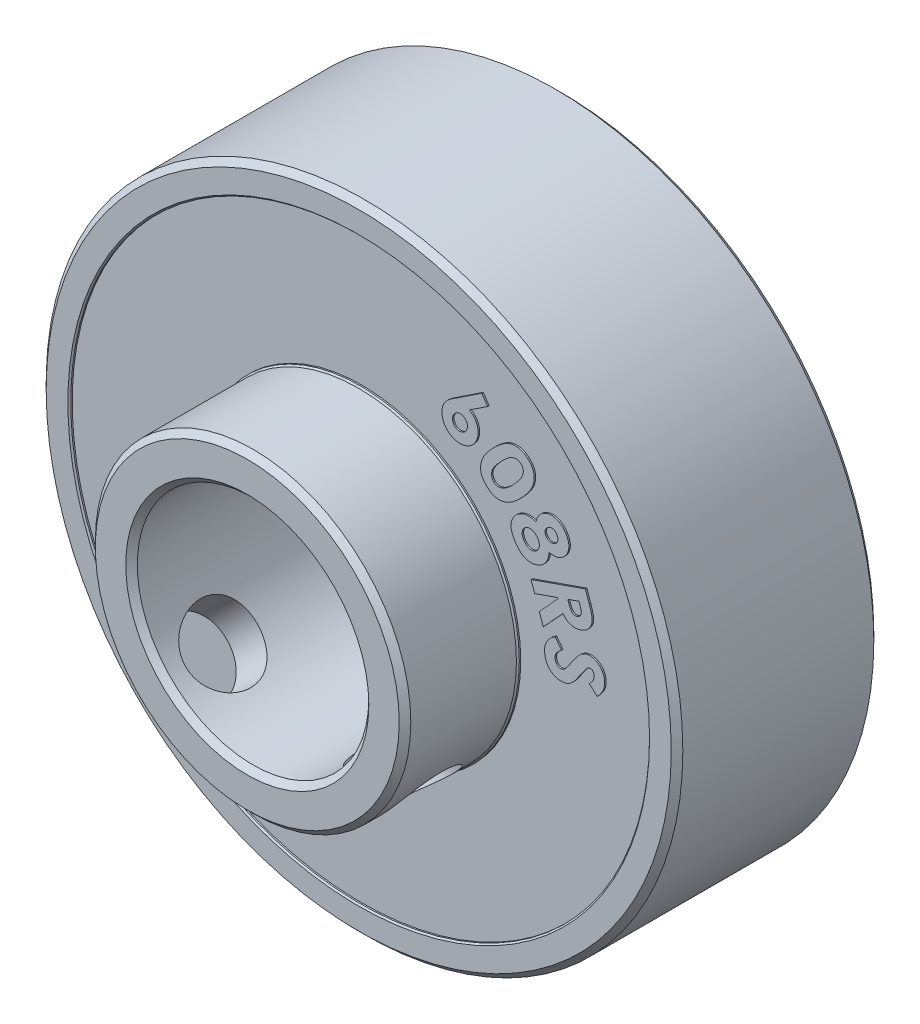
from build123d import *

# Parameters (mm, degrees)
SKETCH_1_R                      = 11
SKETCH_1_R_2                    = 4
EXTRUDE_1_DEPTH                 = 7
SKETCH_2_R                      = 10
SKETCH_2_R_2                    = 5.5
CUT_EXTRUDE_1_DEPTH             = 0.1
CUT_EXTRUDE_START               = -6.9
SKETCH_2_2_R                    = 10
SKETCH_2_2_R_2                  = 5.5
CUT_EXTRUDE_2_DEPTH             = 0.1
CHAMFER_1_SIZE                  = 0.05
SKETCH_3_R                      = 5.45
SKETCH_3_R_2                    = 4
EXTRUDE_2_DEPTH                 = 3.85
EXTRUDE_3_DEPTH                 = 0.05
EXTRUDE_4_DEPTH                 = 0.05
CHAMFER_2_SIZE                  = 0.2
HOLE_WIZARD_M31_D               = 2.5
HOLE_WIZARD_M31_DEPTH           = 5
HOLE_WIZARD_M31_TIP             = 0.751075774
HOLE_WIZARD_M31_ON_FACE_2_D     = 2.5
HOLE_WIZARD_M31_ON_FACE_2_DEPTH = 5
HOLE_WIZARD_M31_ON_FACE_2_TIP   = 0.751075774


with BuildPart() as part:
    # Эскиз1 → Бобышка-Вытянуть1 (new body)
    with BuildSketch(Plane.XY):
        Circle(SKETCH_1_R)
        Circle(SKETCH_1_R_2, mode=Mode.SUBTRACT)
    extrude(amount=EXTRUDE_1_DEPTH)

    # Эскиз2 → Вырез-Вытянуть1 (cut)
    with BuildSketch(Plane.XY.offset(7)):
        Circle(SKETCH_2_R)
        Circle(SKETCH_2_R_2, mode=Mode.SUBTRACT)
    extrude(amount=-CUT_EXTRUDE_1_DEPTH, mode=Mode.SUBTRACT)

    # Эскиз2<2> → Вырез-Вытянуть2 (cut)
    with BuildSketch(Plane.XY.offset(7).offset(CUT_EXTRUDE_START)):
        Circle(SKETCH_2_2_R)
        Circle(SKETCH_2_2_R_2, mode=Mode.SUBTRACT)
    extrude(amount=-CUT_EXTRUDE_2_DEPTH, mode=Mode.SUBTRACT)

    # Фаска1
    chamfer_1_edges = [part.edges().sort_by_distance(p)[0] for p in [
        (-5.5, 0, 0),
        (-5.5, 0, 7),
        (-10, 0, 7),
        (-10, 0, 0),
    ]]
    chamfer(chamfer_1_edges, length=CHAMFER_1_SIZE)

    # Эскиз3 → Бобышка-Вытянуть2 (add)
    with BuildSketch(Plane.XY.offset(7)):
        Circle(SKETCH_3_R)
        Circle(SKETCH_3_R_2, mode=Mode.SUBTRACT)
    extrude(amount=EXTRUDE_2_DEPTH)

    # Эскиз4 → Бобышка-Вытянуть3 (add)
    # profile 1 of 5: a face of its own
    with BuildSketch(Plane(origin=(0, 0, 0.1), x_dir=(-1, 0, 0), z_dir=(0, 0, -1))):
        with BuildLine():
            Line((8.19029949, 0.296762684), (7.915459746, 0.547964607))
            add(Edge.make_bspline(
                [(7.915459746, 0.547964607), (7.930212538, 0.561652705), (7.958620401, 0.5880104), (7.996327588, 0.629118684), (8.027634521, 0.669973123), (8.052746255, 0.710199301), (8.070948356, 0.750293238), (8.083411061, 0.789625849), (8.08946559, 0.828783287), (8.088037669, 0.854577687), (8.087334746, 0.867275505)],
                knots=[0, 0, 0, 0, 1.283643058, 2.471773221, 3.553897725, 4.563664135, 5.490235735, 6.35533973, 7.190382524, 8, 8, 8, 8], degree=3))
            add(Edge.make_bspline(
                [(8.087334746, 0.867275505), (8.085558773, 0.878973611), (8.082125644, 0.901587192), (8.071279685, 0.933093962), (8.055802359, 0.960805758), (8.03577539, 0.983623568), (8.013683645, 1.002156579), (7.990027468, 1.014988722), (7.965398511, 1.021989278), (7.948884251, 1.021409155), (7.940700131, 1.021121659)],
                knots=[0, 0, 0, 0, 1.207749352, 2.334697242, 3.386348666, 4.431866923, 5.42132409, 6.31922352, 7.167042535, 8, 8, 8, 8], degree=3))
            add(Edge.make_bspline(
                [(7.940700131, 1.021121659), (7.932621335, 1.019788328), (7.916352308, 1.017103275), (7.892835161, 1.008040019), (7.870663256, 0.994639244), (7.857349918, 0.983259209), (7.8505559, 0.977451787)],
                knots=[0, 0, 0, 0, 0.962820743, 1.938922399, 2.948197738, 4, 4, 4, 4], degree=3))
            add(Edge.make_bspline(
                [(7.8505559, 0.977451787), (7.84541126, 0.972172886), (7.833449413, 0.959898867), (7.814987093, 0.937231381), (7.792517843, 0.908811056), (7.766476502, 0.874109426), (7.736487579, 0.833524337), (7.703276191, 0.786289932), (7.666020447, 0.733319385), (7.640427557, 0.695574799), (7.626998208, 0.675769095)],
                knots=[0, 0, 0, 0, 0.470536925, 1.094049535, 1.865251957, 2.784627903, 3.864381354, 5.087794006, 6.471879073, 8, 8, 8, 8], degree=3))
            add(Edge.make_bspline(
                [(7.626998208, 0.675769095), (7.614640541, 0.657163929), (7.59117441, 0.62183434), (7.556915793, 0.572340715), (7.526894203, 0.528161762), (7.500632504, 0.48961279), (7.477330699, 0.457159711), (7.457614111, 0.430479971), (7.44217769, 0.408896208), (7.432465201, 0.396888513), (7.428280259, 0.391714607)],
                knots=[0, 0, 0, 0, 1.545917925, 2.935563431, 4.166209933, 5.243077074, 6.163962197, 6.931235012, 7.539487855, 8, 8, 8, 8], degree=3))
            add(Edge.make_bspline(
                [(7.428280259, 0.391714607), (7.4114759, 0.37182383), (7.379248179, 0.333676916), (7.328208941, 0.282837672), (7.277363857, 0.240609472), (7.226534591, 0.206027725), (7.174108624, 0.179103752), (7.119281824, 0.15825443), (7.061278872, 0.142730866), (7.021175822, 0.137275416), (7.000796284, 0.134503069)],
                knots=[0, 0, 0, 0, 1.216684991, 2.333381793, 3.361974081, 4.302038155, 5.200978211, 6.109832555, 7.039456128, 8, 8, 8, 8], degree=3))
            add(Edge.make_bspline(
                [(7.000796284, 0.134503069), (6.980912016, 0.132939575), (6.941838298, 0.12986722), (6.883982913, 0.131513012), (6.82825067, 0.138661818), (6.774544586, 0.151627333), (6.722756945, 0.169984056), (6.673281438, 0.194236918), (6.625975808, 0.223873764), (6.580966464, 0.258411534), (6.539486787, 0.297912458), (6.502409832, 0.341503294), (6.469838994, 0.388631019), (6.44154117, 0.439372329), (6.418347524, 0.49408404), (6.400061376, 0.552505823), (6.385829599, 0.614394453), (6.380248477, 0.657145995), (6.377398849, 0.678974223)],
                knots=[0, 0, 0, 0, 1.030268607, 2.024536377, 2.985077074, 3.929235972, 4.874504223, 5.819066673, 6.770888815, 7.755188857, 8.746217296, 9.725422457, 10.707590718, 11.702433264, 12.722899079, 13.772838986, 14.862848562, 16, 16, 16, 16], degree=3))
            add(Edge.make_bspline(
                [(6.377398849, 0.678974223), (6.375798997, 0.696321208), (6.372653038, 0.730432429), (6.372535986, 0.781177306), (6.375069038, 0.830462562), (6.381642251, 0.878375858), (6.391261519, 0.924960238), (6.403940592, 0.970331043), (6.420541605, 1.014242388), (6.440615795, 1.056859335), (6.464496118, 1.098276227), (6.491701076, 1.138889291), (6.523102827, 1.178239059), (6.558610982, 1.21622944), (6.597564644, 1.253669069), (6.640451848, 1.289953404), (6.686987923, 1.325474587), (6.720207941, 1.347309565), (6.73717449, 1.358461402)],
                knots=[0, 0, 0, 0, 1.024197967, 2.013989355, 2.98174725, 3.924932278, 4.855438404, 5.777986075, 6.692775885, 7.613415354, 8.545842579, 9.502280528, 10.486163035, 11.50337868, 12.558966263, 13.662340886, 14.806081068, 16, 16, 16, 16], degree=3))
            Line((6.73717449, 1.358461402), (6.961132823, 1.063589607))
            add(Edge.make_bspline(
                [(6.961132823, 1.063589607), (6.941783223, 1.04976002), (6.904640351, 1.023213188), (6.85527869, 0.979883822), (6.813922044, 0.936215765), (6.780990044, 0.891951698), (6.756355029, 0.847119192), (6.740509524, 0.801507386), (6.732160003, 0.755241067), (6.733901828, 0.724403811), (6.734770643, 0.7090223)],
                knots=[0, 0, 0, 0, 1.291115503, 2.478383912, 3.561174717, 4.552019659, 5.467235253, 6.327452426, 7.165739371, 8, 8, 8, 8], degree=3))
            add(Edge.make_bspline(
                [(6.734770643, 0.7090223), (6.737047017, 0.693544477), (6.741454544, 0.663576223), (6.756678186, 0.621468176), (6.778461183, 0.583906059), (6.806966887, 0.552326697), (6.838713363, 0.526585695), (6.873193107, 0.5093839), (6.908924688, 0.499647074), (6.93303441, 0.500608287), (6.945107182, 0.501089607)],
                knots=[0, 0, 0, 0, 1.144864229, 2.216693053, 3.261423878, 4.308950986, 5.319950067, 6.239695352, 7.118540031, 8, 8, 8, 8], degree=3))
            add(Edge.make_bspline(
                [(6.945107182, 0.501089607), (6.956297977, 0.502953883), (6.978992459, 0.50673456), (7.011813893, 0.520227563), (7.043931163, 0.539397657), (7.069731885, 0.560640774), (7.091417844, 0.581581651), (7.109058069, 0.602268001), (7.129286143, 0.626178242), (7.150790557, 0.654455491), (7.174432144, 0.686507292), (7.200054137, 0.722495214), (7.227281408, 0.762582694), (7.245640499, 0.790851961), (7.255203336, 0.805576787)],
                knots=[0, 0, 0, 0, 0.909333767, 1.844092184, 2.830712254, 3.906853886, 4.52164093, 5.251643528, 6.089918518, 7.038804142, 8.105700029, 9.291005529, 10.58894572, 12, 12, 12, 12], degree=3))
            add(Edge.make_bspline(
                [(7.255203336, 0.805576787), (7.273676701, 0.833547949), (7.309135378, 0.88723716), (7.361565684, 0.963513784), (7.411212619, 1.031981061), (7.457727497, 1.093115192), (7.501182872, 1.146904816), (7.541988013, 1.192995836), (7.579505878, 1.231717473), (7.624811187, 1.272495506), (7.680872882, 1.312783201), (7.749093256, 1.350896932), (7.819395634, 1.376597714), (7.867344655, 1.384303781), (7.891020643, 1.388108838)],
                knots=[0, 0, 0, 0, 1.354635275, 2.600152879, 3.740128057, 4.772053465, 5.704282852, 6.533881209, 7.258997855, 7.881984621, 8.994978827, 10.040768623, 11.032582161, 12, 12, 12, 12], degree=3))
            add(Edge.make_bspline(
                [(7.891020643, 1.388108838), (7.907837345, 1.389379919), (7.941058613, 1.391890929), (7.990627945, 1.389771243), (8.038890595, 1.382682444), (8.085784404, 1.369905718), (8.1315722, 1.352830166), (8.175904073, 1.330212525), (8.21850955, 1.302087689), (8.259844147, 1.270033589), (8.298457845, 1.234037671), (8.332687216, 1.194351501), (8.362795003, 1.152283012), (8.388809922, 1.107439648), (8.409857622, 1.05948486), (8.427255893, 1.009050899), (8.43972419, 0.955578355), (8.444613189, 0.918875245), (8.447110387, 0.900128069)],
                knots=[0, 0, 0, 0, 0.982658787, 1.941235034, 2.886113445, 3.821089462, 4.769842375, 5.731008605, 6.715886282, 7.742366117, 8.778049333, 9.788214007, 10.79299206, 11.790714915, 12.805102541, 13.84180981, 14.897641854, 16, 16, 16, 16], degree=3))
            add(Edge.make_bspline(
                [(8.447110387, 0.900128069), (8.448935719, 0.875698903), (8.452568899, 0.827074558), (8.446914222, 0.754085903), (8.432729231, 0.682042073), (8.413680399, 0.622888679), (8.393507869, 0.575406695), (8.374555687, 0.538716982), (8.352421563, 0.500825792), (8.326600844, 0.4621087), (8.297870618, 0.421941161), (8.265169611, 0.381074719), (8.229131565, 0.339066076), (8.203470577, 0.311111175), (8.19029949, 0.296762684)],
                knots=[0, 0, 0, 0, 1.297254647, 2.582083941, 3.866503492, 5.183090301, 5.868268373, 6.599732141, 7.370831279, 8.193636159, 9.066090408, 9.988293336, 10.967445722, 12, 12, 12, 12], degree=3))
        make_face()
    # profile 2 of 5: a face of its own
    with BuildSketch(Plane(origin=(0, 0, 0.1), x_dir=(-1, 0, 0), z_dir=(0, 0, -1))):
        with BuildLine():
            Line((7.783437326, 3.311270875), (7.916049505, 2.931863824))
            add(Edge.make_bspline(
                [(7.916049505, 2.931863824), (7.924769277, 2.906813762), (7.941572283, 2.858542271), (7.963024934, 2.788029468), (7.981292416, 2.722622896), (7.995695135, 2.662213175), (8.006872453, 2.606813373), (8.013669165, 2.556351502), (8.017163917, 2.510850173), (8.016823721, 2.469705288), (8.013181297, 2.4313611), (8.006195484, 2.394738008), (7.9970776, 2.358609232), (7.984653781, 2.323511961), (7.96914369, 2.289215094), (7.951395761, 2.255452582), (7.929654367, 2.223113567), (7.906410686, 2.190975053), (7.879929518, 2.160614922), (7.850983844, 2.132280666), (7.820175082, 2.105381599), (7.786052597, 2.081795139), (7.750622108, 2.058414709), (7.711991084, 2.038403077), (7.671445547, 2.019658329), (7.6431591, 2.00926096), (7.62878989, 2.003979209)],
                knots=[0, 0, 0, 0, 1.706955509, 3.289304765, 4.742725008, 6.076968942, 7.285589652, 8.378391958, 9.352075536, 10.220228812, 11.023312621, 11.827453633, 12.617553708, 13.419486802, 14.219759959, 15.038829142, 15.870829558, 16.725215705, 17.59038548, 18.459516813, 19.331194434, 20.218454335, 21.126861048, 22.061206263, 23.015113666, 24, 24, 24, 24], degree=3))
            add(Edge.make_bspline(
                [(7.62878989, 2.003979209), (7.613633286, 1.998940047), (7.58387039, 1.989044688), (7.538798529, 1.978394979), (7.494653902, 1.970684925), (7.451417635, 1.966152981), (7.40905723, 1.965274454), (7.3676703, 1.968216093), (7.327141762, 1.974045178), (7.287587328, 1.983779464), (7.249163118, 1.997053821), (7.211496131, 2.013653627), (7.174820214, 2.03367515), (7.138912407, 2.056937192), (7.104358371, 2.084204536), (7.070277885, 2.114486214), (7.037441286, 2.148719433), (7.016740509, 2.173330977), (7.006193736, 2.185870234)],
                knots=[0, 0, 0, 0, 1.096708063, 2.153596337, 3.177645909, 4.173531218, 5.136944437, 6.084015114, 7.02072131, 7.946310815, 8.877565628, 9.809949373, 10.770519432, 11.745049659, 12.745151267, 13.791154223, 14.874622174, 16, 16, 16, 16], degree=3))
            Line((7.006193736, 2.185870234), (6.326305916, 1.449091388))
            Line((6.326305916, 1.449091388), (6.189687326, 1.839716388))
            Line((6.189687326, 1.839716388), (6.837123223, 2.541639465))
            Line((6.837123223, 2.541639465), (6.825504634, 2.574492029))
            Line((6.825504634, 2.574492029), (6.029831557, 2.295645875))
            Line((6.029831557, 2.295645875), (5.904831557, 2.653418311))
            Line((5.904831557, 2.653418311), (7.783437326, 3.311270875))
        make_face()
        with BuildLine():
            Line((7.174062326, 2.696286901), (7.213725787, 2.584107414))
            add(Edge.make_bspline(
                [(7.213725787, 2.584107414), (7.218691825, 2.570443194), (7.228199165, 2.544283427), (7.243590818, 2.507335062), (7.25855833, 2.473783305), (7.274594183, 2.444335865), (7.290510547, 2.418541625), (7.306626959, 2.39661665), (7.322900646, 2.378338402), (7.340039177, 2.364089402), (7.357804561, 2.352860045), (7.376557924, 2.344495657), (7.396509399, 2.338777176), (7.417431195, 2.335993291), (7.439480594, 2.33620775), (7.462604378, 2.33850186), (7.486837126, 2.343916635), (7.503026628, 2.349069729), (7.511402069, 2.351735619)],
                knots=[0, 0, 0, 0, 1.601891661, 3.066776947, 4.410195398, 5.648149463, 6.758846487, 7.747826659, 8.643734474, 9.448322519, 10.195548691, 10.953137507, 11.703112172, 12.475283592, 13.269985724, 14.128109779, 15.031600479, 16, 16, 16, 16], degree=3))
            add(Edge.make_bspline(
                [(7.511402069, 2.351735619), (7.521147096, 2.35559951), (7.540209085, 2.363157563), (7.566074549, 2.378945612), (7.588463677, 2.398071694), (7.607385114, 2.420242858), (7.622629573, 2.444952802), (7.633390541, 2.471694709), (7.640549153, 2.499855194), (7.642219977, 2.524775568), (7.641954507, 2.546526319), (7.639054197, 2.565454062), (7.635740431, 2.587201882), (7.629849179, 2.61128605), (7.623047983, 2.638033071), (7.614660766, 2.667347576), (7.60409895, 2.699141683), (7.596615811, 2.721264102), (7.592732198, 2.732745234)],
                knots=[0, 0, 0, 0, 1.127833703, 2.206125587, 3.247006354, 4.287887121, 5.334123575, 6.360081624, 7.382502748, 8.450668697, 9.040729981, 9.722428417, 10.510067932, 11.410520644, 12.39108699, 13.483965865, 14.694224073, 16, 16, 16, 16], degree=3))
            Line((7.592732198, 2.732745234), (7.558277069, 2.830902286))
            Line((7.558277069, 2.830902286), (7.174062326, 2.696286901))
        make_face(mode=Mode.SUBTRACT)
    # profile 3 of 5: a face of its own
    with BuildSketch(Plane(origin=(0, 0, 0.1), x_dir=(-1, 0, 0), z_dir=(0, 0, -1))):
        with BuildLine():
            add(Edge.make_bspline(
                [(6.524956198, 3.777500663), (6.524304606, 3.75126623), (6.523019287, 3.69951662), (6.509214831, 3.623469832), (6.486888654, 3.550377208), (6.454692656, 3.481106031), (6.414135167, 3.416737269), (6.366520042, 3.357464227), (6.311106445, 3.304622347), (6.269210325, 3.275126123), (6.24811325, 3.260273099)],
                knots=[0, 0, 0, 0, 1.027340805, 2.026515475, 3.018313015, 4.016060567, 5.010961512, 5.993641018, 6.989684333, 8, 8, 8, 8], degree=3))
            add(Edge.make_bspline(
                [(6.24811325, 3.260273099), (6.224201635, 3.24561151), (6.17684081, 3.216571858), (6.099236998, 3.186803655), (6.01938164, 3.165575641), (5.937038073, 3.156819994), (5.855027357, 3.158202871), (5.775198976, 3.170467796), (5.699052471, 3.194578876), (5.638722513, 3.223379802), (5.592328757, 3.251989183), (5.558324524, 3.277540386), (5.524468605, 3.306017131), (5.491500637, 3.338079993), (5.458736035, 3.37313351), (5.426897068, 3.411715615), (5.394976108, 3.453295723), (5.375210263, 3.483040176), (5.365100429, 3.498253869)],
                knots=[0, 0, 0, 0, 1.303214694, 2.581227698, 3.852387222, 5.141062064, 6.422020446, 7.661855004, 8.886870759, 10.127110528, 10.763715695, 11.421492558, 12.105285765, 12.821976999, 13.560998413, 14.337908647, 15.149873567, 16, 16, 16, 16], degree=3))
            add(Edge.make_bspline(
                [(5.365100429, 3.498253869), (5.354502757, 3.514704801), (5.333927015, 3.546644847), (5.306890227, 3.595047921), (5.282338511, 3.641528806), (5.262354463, 3.687127168), (5.244439697, 3.730923542), (5.231573515, 3.773839499), (5.221254139, 3.81509366), (5.212673344, 3.868081762), (5.210257913, 3.933529132), (5.218138208, 4.011453013), (5.23833589, 4.088242466), (5.269077889, 4.163401809), (5.310608357, 4.23497626), (5.362631133, 4.300895298), (5.424017297, 4.360800087), (5.47130671, 4.394041983), (5.495308762, 4.410914125)],
                knots=[0, 0, 0, 0, 0.898227396, 1.743939131, 2.544713256, 3.310472017, 4.028938821, 4.715510003, 5.365398198, 5.980299854, 7.176961092, 8.360591663, 9.563707498, 10.809381662, 12.078734392, 13.349508007, 14.654725381, 16, 16, 16, 16], degree=3))
            add(Edge.make_bspline(
                [(5.495308762, 4.410914125), (5.517046647, 4.42416132), (5.559907764, 4.450281137), (5.628614186, 4.479326872), (5.698842436, 4.500288226), (5.771076481, 4.511315454), (5.845080326, 4.51387535), (5.920712713, 4.506597977), (5.998241639, 4.491231127), (6.049031122, 4.47388316), (6.075036327, 4.465000663)],
                knots=[0, 0, 0, 0, 1.00787022, 1.987242288, 2.947077545, 3.906153439, 4.875401634, 5.874657719, 6.911783381, 8, 8, 8, 8], degree=3))
            add(Edge.make_bspline(
                [(6.075036327, 4.465000663), (6.079748712, 4.485000462), (6.08900671, 4.524292258), (6.108878062, 4.580592191), (6.132866916, 4.633167242), (6.161056962, 4.68208808), (6.193554197, 4.727069924), (6.23039082, 4.768198609), (6.271094728, 4.805929575), (6.30165577, 4.82700098), (6.317023506, 4.837596817)],
                knots=[0, 0, 0, 0, 1.080470016, 2.122701697, 3.135136799, 4.117374167, 5.08859185, 6.049074693, 7.018969745, 8, 8, 8, 8], degree=3))
            add(Edge.make_bspline(
                [(6.317023506, 4.837596817), (6.338621255, 4.850591328), (6.381279936, 4.876257369), (6.450042003, 4.904438052), (6.521125204, 4.922536534), (6.593761558, 4.931015777), (6.66658219, 4.929470684), (6.738206504, 4.917758792), (6.807993188, 4.89585596), (6.875130473, 4.86347001), (6.939734421, 4.822231048), (6.999368558, 4.770616513), (7.055561568, 4.710751211), (7.087231726, 4.664839989), (7.103481839, 4.641282715)],
                knots=[0, 0, 0, 0, 0.997889349, 1.970975918, 2.932492279, 3.896932359, 4.860471542, 5.809804719, 6.763994604, 7.748871042, 8.756037824, 9.792283038, 10.867209569, 12, 12, 12, 12], degree=3))
            add(Edge.make_bspline(
                [(7.103481839, 4.641282715), (7.118266706, 4.617313906), (7.147135927, 4.570511938), (7.178984369, 4.496086455), (7.201762696, 4.421603302), (7.212798322, 4.346671449), (7.21415521, 4.272579683), (7.205418076, 4.199672689), (7.185759495, 4.128747746), (7.156971958, 4.060319699), (7.119520913, 3.996303386), (7.074614409, 3.93771315), (7.021994485, 3.885977177), (6.981835267, 3.857510527), (6.961654916, 3.843205792)],
                knots=[0, 0, 0, 0, 1.117294016, 2.181650263, 3.205496746, 4.203313101, 5.179532074, 6.141507601, 7.109258008, 8.093515385, 9.082507538, 10.047010183, 11.018605923, 12, 12, 12, 12], degree=3))
            add(Edge.make_bspline(
                [(6.961654916, 3.843205792), (6.946865794, 3.834091177), (6.917520408, 3.816005458), (6.871055379, 3.794448162), (6.823354409, 3.778282963), (6.773824196, 3.767141239), (6.720213606, 3.76162371), (6.660932763, 3.761454913), (6.594959848, 3.767025459), (6.549092294, 3.773888987), (6.524956198, 3.777500663)],
                knots=[0, 0, 0, 0, 0.918312471, 1.822165875, 2.702300176, 3.578058076, 4.501680321, 5.547167614, 6.70928807, 8, 8, 8, 8], degree=3))
        make_face()
        with BuildLine():
            add(Edge.make_bspline(
                [(6.792985044, 4.452180151), (6.784193133, 4.46416284), (6.767096261, 4.487464544), (6.734901369, 4.515655868), (6.698260579, 4.535858726), (6.658209729, 4.547577881), (6.616386986, 4.551923369), (6.57431036, 4.546702239), (6.532477779, 4.533439362), (6.506928956, 4.51817378), (6.493706198, 4.510273099)],
                knots=[0, 0, 0, 0, 1.042245895, 2.026765742, 2.980375271, 3.960320729, 4.940985148, 5.914300286, 6.920549047, 8, 8, 8, 8], degree=3))
            add(Edge.make_bspline(
                [(6.493706198, 4.510273099), (6.481273951, 4.501259963), (6.457078344, 4.483718619), (6.428218724, 4.449879888), (6.406350839, 4.411948623), (6.393096116, 4.370141725), (6.387590231, 4.326853426), (6.39146996, 4.283978738), (6.403334912, 4.24191666), (6.418307167, 4.216723511), (6.425997865, 4.203782715)],
                knots=[0, 0, 0, 0, 1.050136953, 2.043773826, 3.024360851, 4.035412181, 5.031916455, 5.997323732, 6.971298728, 8, 8, 8, 8], degree=3))
            add(Edge.make_bspline(
                [(6.425997865, 4.203782715), (6.435011379, 4.191354446), (6.45244255, 4.167319505), (6.485892403, 4.138647115), (6.523427725, 4.117682381), (6.564854226, 4.105334124), (6.608250747, 4.101721075), (6.65195102, 4.107155926), (6.695508259, 4.121394594), (6.722213073, 4.137380449), (6.736094019, 4.145689766)],
                knots=[0, 0, 0, 0, 1.038512025, 2.008370975, 2.961327375, 3.935787341, 4.91758916, 5.894068385, 6.905353861, 8, 8, 8, 8], degree=3))
            add(Edge.make_bspline(
                [(6.736094019, 4.145689766), (6.748494201, 4.15472618), (6.772393198, 4.172142151), (6.801283613, 4.205039318), (6.821620674, 4.242147084), (6.833728295, 4.282699071), (6.837325661, 4.325259879), (6.832037499, 4.368536184), (6.817067328, 4.411608544), (6.801236238, 4.438279303), (6.792985044, 4.452180151)],
                knots=[0, 0, 0, 0, 1.049071613, 2.02188637, 2.97209824, 3.927539907, 4.901086152, 5.878410172, 6.8942235, 8, 8, 8, 8], degree=3))
        make_face(mode=Mode.SUBTRACT)
        with BuildLine():
            add(Edge.make_bspline(
                [(6.136334403, 4.004664125), (6.13009776, 4.013874061), (6.11785514, 4.031953296), (6.096760064, 4.056514476), (6.074306033, 4.078383855), (6.050915758, 4.098498769), (6.025737138, 4.11559388), (5.998998784, 4.130127408), (5.971014648, 4.142231902), (5.941785246, 4.151195914), (5.912521492, 4.158134596), (5.883498299, 4.161892425), (5.855199959, 4.161970264), (5.827551938, 4.160548685), (5.800857083, 4.154321839), (5.774739409, 4.146706669), (5.749492095, 4.135210911), (5.733721651, 4.125435627), (5.725677352, 4.120449381)],
                knots=[0, 0, 0, 0, 1.124817388, 2.208032344, 3.268759496, 4.294831262, 5.325608786, 6.341574749, 7.370756504, 8.405071366, 9.431143132, 10.411710123, 11.357773941, 12.292672367, 13.204429581, 14.1234686, 15.042805637, 16, 16, 16, 16], degree=3))
            add(Edge.make_bspline(
                [(5.725677352, 4.120449381), (5.717529274, 4.114883698), (5.701561999, 4.10397698), (5.68010388, 4.084700625), (5.660992867, 4.064096017), (5.644205352, 4.041736022), (5.630411043, 4.017670084), (5.618371377, 3.992225053), (5.609936395, 3.96474385), (5.600554267, 3.926611276), (5.597012573, 3.876636245), (5.605317848, 3.815990821), (5.62666386, 3.755396987), (5.649123685, 3.717717789), (5.660773506, 3.69817374)],
                knots=[0, 0, 0, 0, 0.741926806, 1.453907122, 2.165177658, 2.854668687, 3.552822827, 4.249890908, 4.968227687, 5.711786598, 7.203414907, 8.704461029, 10.29061715, 12, 12, 12, 12], degree=3))
            add(Edge.make_bspline(
                [(5.660773506, 3.69817374), (5.667419067, 3.688432773), (5.68032333, 3.669517893), (5.701990641, 3.643861805), (5.723720515, 3.620157861), (5.747571594, 3.600482521), (5.771764178, 3.582691541), (5.797441383, 3.568450996), (5.823982749, 3.55672109), (5.859996585, 3.545016882), (5.906140241, 3.537875307), (5.961513481, 3.541793389), (6.016185928, 3.556831626), (6.048970267, 3.576358158), (6.065821583, 3.586394894)],
                knots=[0, 0, 0, 0, 0.898110874, 1.743939712, 2.557551234, 3.344755697, 4.096134693, 4.843573406, 5.577372218, 6.304860648, 7.72571922, 9.102920365, 10.510886413, 12, 12, 12, 12], degree=3))
            add(Edge.make_bspline(
                [(6.065821583, 3.586394894), (6.074104374, 3.592094128), (6.090343606, 3.603268041), (6.112047838, 3.62282216), (6.131556168, 3.643732013), (6.148263617, 3.666508804), (6.162537936, 3.690928681), (6.17409487, 3.716856498), (6.182971535, 3.744550922), (6.191374447, 3.783030953), (6.195208405, 3.832665775), (6.187873983, 3.892196313), (6.168263984, 3.950564247), (6.147169347, 3.986305941), (6.136334403, 4.004664125)],
                knots=[0, 0, 0, 0, 0.763890001, 1.497682027, 2.216418851, 2.93551438, 3.640997123, 4.363883981, 5.089761223, 5.848774416, 7.356060518, 8.850114758, 10.382108777, 12, 12, 12, 12], degree=3))
        make_face(mode=Mode.SUBTRACT)
    # profile 4 of 5: a face of its own
    with BuildSketch(Plane(origin=(0, 0, 0.1), x_dir=(-1, 0, 0), z_dir=(0, 0, -1))):
        with BuildLine():
            add(Edge.make_bspline(
                [(5.801031456, 6.207524346), (5.813924149, 6.19516843), (5.839258812, 6.170888556), (5.873240427, 6.131552721), (5.904337569, 6.091732955), (5.931202969, 6.050203969), (5.954578485, 6.00765238), (5.974175214, 5.963941836), (5.990412551, 5.919122663), (6.002811928, 5.87316911), (6.011288642, 5.825990893), (6.015662793, 5.777736132), (6.016039892, 5.728424058), (6.012315001, 5.678071857), (6.004775946, 5.626596852), (5.992439913, 5.574248861), (5.976901865, 5.52061597), (5.956647666, 5.465884361), (5.931706733, 5.409648841), (5.901395785, 5.351538184), (5.865064267, 5.291571875), (5.823556266, 5.229131962), (5.77584573, 5.164993724), (5.723039625, 5.09838208), (5.664069155, 5.030090285), (5.62220254, 4.984521939), (5.600710943, 4.961130116)],
                knots=[0, 0, 0, 0, 0.896879839, 1.762405055, 2.609389887, 3.433985627, 4.244867897, 5.046870708, 5.838672706, 6.637975543, 7.435699174, 8.244384643, 9.06985378, 9.910888981, 10.779297254, 11.681184557, 12.61131757, 13.583728112, 14.611264553, 15.700852567, 16.874782266, 18.133001721, 19.467173721, 20.890456197, 22.403762549, 24, 24, 24, 24], degree=3))
            add(Edge.make_bspline(
                [(5.600710943, 4.961130116), (5.578574221, 4.937730565), (5.53553699, 4.8922382), (5.470143519, 4.828685195), (5.406915097, 4.770678283), (5.345118899, 4.719024874), (5.285373377, 4.672743209), (5.227523425, 4.631969579), (5.170803391, 4.598001666), (5.116096466, 4.569016085), (5.06243213, 4.546170599), (5.010713129, 4.525910001), (4.959664435, 4.510976756), (4.909849023, 4.49902272), (4.861076695, 4.491450342), (4.813389159, 4.487710773), (4.766869748, 4.488076327), (4.72128448, 4.492499047), (4.676621178, 4.500918166), (4.632577225, 4.513575497), (4.588958731, 4.529896866), (4.545809118, 4.550660242), (4.503112836, 4.575039305), (4.460701317, 4.603269861), (4.419014914, 4.635790627), (4.392360922, 4.659940842), (4.378755815, 4.672267936)],
                knots=[0, 0, 0, 0, 1.62553563, 3.160293989, 4.601160432, 5.955180386, 7.223786167, 8.414819195, 9.52450069, 10.558549837, 11.536513283, 12.466596714, 13.360084421, 14.218407688, 15.050610811, 15.848251286, 16.630130654, 17.395360827, 18.156782084, 18.920586139, 19.705509938, 20.50443085, 21.334584377, 22.185145146, 23.073636135, 24, 24, 24, 24], degree=3))
            add(Edge.make_bspline(
                [(4.378755815, 4.672267936), (4.365634432, 4.685061046), (4.339843255, 4.710206974), (4.304648643, 4.750063775), (4.272741847, 4.79028845), (4.245499753, 4.831912791), (4.221613223, 4.874121738), (4.20164739, 4.917262906), (4.185365472, 4.961289792), (4.173362624, 5.006229307), (4.165360005, 5.052232285), (4.161057919, 5.099112779), (4.159946093, 5.147101322), (4.164134458, 5.19604944), (4.170472007, 5.246243105), (4.182172222, 5.297251014), (4.196962286, 5.349286742), (4.21546285, 5.402866783), (4.239285853, 5.457901636), (4.268834207, 5.514908125), (4.303815023, 5.574323931), (4.344730164, 5.635979916), (4.39190103, 5.699589283), (4.444457346, 5.765806637), (4.502875575, 5.834210328), (4.544736781, 5.879668888), (4.566255815, 5.903037167)],
                knots=[0, 0, 0, 0, 0.93145521, 1.830853238, 2.701521204, 3.539567412, 4.357371131, 5.165476893, 5.953858164, 6.741156795, 7.527048697, 8.324992091, 9.133126379, 9.96376784, 10.820341906, 11.703392463, 12.621159873, 13.570315713, 14.583154331, 15.667295202, 16.832996866, 18.087234292, 19.427652897, 20.858187109, 22.384929949, 24, 24, 24, 24], degree=3))
            add(Edge.make_bspline(
                [(4.566255815, 5.903037167), (4.596827081, 5.934964931), (4.655824296, 5.996579952), (4.745593631, 6.081166655), (4.832620022, 6.155531077), (4.917492881, 6.218720737), (4.999409849, 6.27248489), (5.079241472, 6.314911903), (5.156191022, 6.348236977), (5.208016495, 6.361707711), (5.232922482, 6.368181398)],
                knots=[0, 0, 0, 0, 1.287451315, 2.484556693, 3.591331551, 4.619887002, 5.565116891, 6.442227226, 7.251374558, 8, 8, 8, 8], degree=3))
            add(Edge.make_bspline(
                [(5.232922482, 6.368181398), (5.259279446, 6.373132216), (5.311020478, 6.382851106), (5.38873757, 6.385634438), (5.464011498, 6.379965509), (5.536719427, 6.36406757), (5.60708657, 6.338928427), (5.675008317, 6.30461439), (5.740730452, 6.261103079), (5.78060957, 6.225669629), (5.801031456, 6.207524346)],
                knots=[0, 0, 0, 0, 1.043642178, 2.048761185, 3.019736125, 3.97808078, 4.939232424, 5.92356981, 6.936671029, 8, 8, 8, 8], degree=3))
        make_face()
        with BuildLine():
            add(Edge.make_bspline(
                [(5.561448123, 5.937892936), (5.54949212, 5.948094367), (5.526055929, 5.968091241), (5.48526411, 5.990222344), (5.441166125, 6.004103016), (5.40219865, 6.00973176), (5.369591787, 6.010643547), (5.343747909, 6.007364632), (5.316691723, 6.002411823), (5.288853121, 5.993630665), (5.259641396, 5.982944659), (5.229805065, 5.968561691), (5.198284581, 5.952284519), (5.165827919, 5.932324526), (5.131501983, 5.909533566), (5.095831072, 5.882268356), (5.057770723, 5.851541594), (5.017762092, 5.816430382), (4.97530072, 5.777819734), (4.931290096, 5.734585593), (4.884755595, 5.687887076), (4.853570697, 5.654849218), (4.837489789, 5.637812808)],
                knots=[0, 0, 0, 0, 1.078457542, 2.113995491, 3.165252164, 4.24183154, 4.8112373, 5.402439376, 6.029159191, 6.700255689, 7.406374243, 8.166383653, 8.9755623, 9.844875258, 10.784663416, 11.807625589, 12.93055478, 14.147713473, 15.467127592, 16.876286332, 18.389215538, 20, 20, 20, 20], degree=3))
            add(Edge.make_bspline(
                [(4.837489789, 5.637812808), (4.817040713, 5.615509933), (4.777765071, 5.572673781), (4.72358216, 5.508851829), (4.676000212, 5.448681173), (4.636315581, 5.39120832), (4.603214592, 5.337542892), (4.576727967, 5.287418759), (4.557496626, 5.240503726), (4.545677609, 5.196541141), (4.539589736, 5.155502193), (4.537998194, 5.116969893), (4.54005798, 5.080309837), (4.547439043, 5.045872129), (4.558631271, 5.013497936), (4.574165414, 4.983227409), (4.594136837, 4.955123298), (4.610485374, 4.938615556), (4.618739789, 4.930280757)],
                knots=[0, 0, 0, 0, 1.764330829, 3.388672662, 4.881067554, 6.235525549, 7.458945136, 8.556138335, 9.538053795, 10.408906489, 11.204079648, 11.952336581, 12.654775104, 13.339019898, 13.999083847, 14.646906155, 15.316819627, 16, 16, 16, 16], degree=3))
            add(Edge.make_bspline(
                [(4.618739789, 4.930280757), (4.627241972, 4.922969808), (4.643986105, 4.908571683), (4.671887381, 4.891244126), (4.701417265, 4.878239617), (4.732609899, 4.869779355), (4.765527544, 4.865754705), (4.799954191, 4.866443213), (4.836028136, 4.870687125), (4.859985852, 4.876962951), (4.872345559, 4.880200628)],
                knots=[0, 0, 0, 0, 0.990256165, 1.950202826, 2.891302884, 3.833661247, 4.797304066, 5.812790631, 6.87162592, 8, 8, 8, 8], degree=3))
            add(Edge.make_bspline(
                [(4.872345559, 4.880200628), (4.888239843, 4.885466484), (4.921729172, 4.896561665), (4.971713666, 4.921276575), (5.02428298, 4.952714721), (5.079174526, 4.991458443), (5.136493986, 5.0374372), (5.196364395, 5.090401555), (5.259185568, 5.150147434), (5.300431109, 5.193703881), (5.321864789, 5.216338449)],
                knots=[0, 0, 0, 0, 0.707909902, 1.491569345, 2.353275058, 3.298764867, 4.332382232, 5.461687153, 6.680938905, 8, 8, 8, 8], degree=3))
            add(Edge.make_bspline(
                [(5.321864789, 5.216338449), (5.343122606, 5.23943443), (5.384079707, 5.283933093), (5.440429588, 5.350152791), (5.48954109, 5.412895734), (5.53175079, 5.471472335), (5.566683898, 5.526595246), (5.593991726, 5.578177571), (5.614630273, 5.626023181), (5.627649962, 5.67078917), (5.634880992, 5.71248432), (5.63789165, 5.751686534), (5.636437143, 5.788568573), (5.630412955, 5.823218701), (5.619901141, 5.855597497), (5.605110815, 5.8858054), (5.585535276, 5.913595223), (5.569573787, 5.92969624), (5.561448123, 5.937892936)],
                knots=[0, 0, 0, 0, 1.790505423, 3.449738563, 4.958437556, 6.334645182, 7.566924544, 8.677841254, 9.661171365, 10.533905407, 11.33046538, 12.071346386, 12.772877167, 13.430424381, 14.071254209, 14.708360098, 15.342452786, 16, 16, 16, 16], degree=3))
        make_face(mode=Mode.SUBTRACT)
    # profile 5 of 5: a face of its own
    with BuildSketch(Plane(origin=(0, 0, 0.1), x_dir=(-1, 0, 0), z_dir=(0, 0, -1))):
        with BuildLine():
            Line((4.204330023, 7.378835528), (4.405451818, 7.080758605))
            Line((4.405451818, 7.080758605), (3.771237074, 6.662489374))
            add(Edge.make_bspline(
                [(3.771237074, 6.662489374), (3.788948954, 6.651870835), (3.823829351, 6.63095951), (3.871823477, 6.594203067), (3.914749666, 6.553410061), (3.953715543, 6.509517197), (3.986416935, 6.460769843), (4.015222891, 6.40891339), (4.038725909, 6.352970088), (4.057443164, 6.294120739), (4.070599254, 6.233620565), (4.07790034, 6.172716553), (4.079228374, 6.112171987), (4.073970464, 6.0518571), (4.062070404, 5.992103974), (4.044788927, 5.932359507), (4.021322095, 5.872886796), (4.000800903, 5.834840366), (3.990387715, 5.815534246)],
                knots=[0, 0, 0, 0, 1.01594452, 2.000722089, 2.967966702, 3.927721352, 4.883143816, 5.851102988, 6.843747715, 7.864529688, 8.887003591, 9.886654211, 10.879473055, 11.86266964, 12.86052468, 13.873658011, 14.921017937, 16, 16, 16, 16], degree=3))
            add(Edge.make_bspline(
                [(3.990387715, 5.815534246), (3.979568037, 5.797236083), (3.958268039, 5.761213677), (3.919849288, 5.712481993), (3.879388109, 5.667394465), (3.833755664, 5.628444703), (3.784983061, 5.593781209), (3.73206478, 5.564504211), (3.675710328, 5.540006158), (3.616435273, 5.520513129), (3.55566895, 5.506662972), (3.49478542, 5.498297041), (3.434642606, 5.496979323), (3.375145197, 5.500703819), (3.3164849, 5.511318428), (3.258456363, 5.527984367), (3.200973239, 5.550158103), (3.164349044, 5.56968588), (3.145836433, 5.579556682)],
                knots=[0, 0, 0, 0, 1.044355035, 2.055954016, 3.046108564, 4.01929933, 4.999711365, 5.984732998, 6.987787716, 8.018022592, 9.048927268, 10.04939801, 11.034988855, 12.002756169, 12.976810999, 13.960232698, 14.968948864, 16, 16, 16, 16], degree=3))
            add(Edge.make_bspline(
                [(3.145836433, 5.579556682), (3.126900784, 5.590809206), (3.089767666, 5.612875592), (3.038915686, 5.651766519), (2.993641834, 5.694377274), (2.95302519, 5.74017481), (2.918424422, 5.790325388), (2.88925237, 5.844140103), (2.864931095, 5.901520205), (2.846519572, 5.961864927), (2.833250825, 6.023391038), (2.826203937, 6.084577253), (2.823872151, 6.144498742), (2.827810032, 6.203211252), (2.838212101, 6.260531864), (2.853173011, 6.316772679), (2.874548952, 6.371671255), (2.892952523, 6.406512466), (2.90224669, 6.424107964)],
                knots=[0, 0, 0, 0, 1.081888934, 2.121601975, 3.138545199, 4.133886447, 5.124368109, 6.125944256, 7.137769764, 8.18205145, 9.222220187, 10.226867113, 11.205402434, 12.165941497, 13.112315172, 14.064475316, 15.022521888, 16, 16, 16, 16], degree=3))
            add(Edge.make_bspline(
                [(2.90224669, 6.424107964), (2.910044621, 6.437334588), (2.925715714, 6.46391544), (2.953261568, 6.501442495), (2.983354204, 6.537701428), (3.011312844, 6.566804718), (3.036983313, 6.590155052), (3.059591344, 6.609655966), (3.085863372, 6.630529392), (3.11551908, 6.652972296), (3.148943875, 6.67691527), (3.185556775, 6.70305142), (3.226129647, 6.730085917), (3.25426887, 6.748639551), (3.268833228, 6.758242579)],
                knots=[0, 0, 0, 0, 1.101910966, 2.214452613, 3.337892719, 4.484022691, 5.108442505, 5.829247805, 6.627479611, 7.517388936, 8.499500422, 9.579708563, 10.74730053, 12, 12, 12, 12], degree=3))
            Line((3.268833228, 6.758242579), (4.204330023, 7.378835528))
        make_face()
        with BuildLine():
            add(Edge.make_bspline(
                [(3.576926177, 6.361607964), (3.561709724, 6.369292664), (3.532055196, 6.384268964), (3.483253287, 6.394005894), (3.433831049, 6.394320254), (3.384691225, 6.382882802), (3.337565185, 6.363314648), (3.295005729, 6.334070127), (3.257806818, 6.296313051), (3.238891001, 6.265873356), (3.229169766, 6.250229759)],
                knots=[0, 0, 0, 0, 1.000533138, 1.94988536, 2.902234447, 3.893374452, 4.902047154, 5.893155908, 6.917248627, 8, 8, 8, 8], degree=3))
            add(Edge.make_bspline(
                [(3.229169766, 6.250229759), (3.220864632, 6.233808281), (3.204656611, 6.201760679), (3.192372983, 6.14967388), (3.189723737, 6.097047863), (3.197899343, 6.045124659), (3.214835188, 5.996428523), (3.239947163, 5.953633769), (3.272607071, 5.917359646), (3.299623629, 5.900030568), (3.313304382, 5.8912554)],
                knots=[0, 0, 0, 0, 1.076981574, 2.101800953, 3.114161618, 4.153007014, 5.167065966, 6.122976348, 7.049505219, 8, 8, 8, 8], degree=3))
            add(Edge.make_bspline(
                [(3.313304382, 5.8912554), (3.328526115, 5.883591915), (3.358567236, 5.868467508), (3.408033862, 5.858449103), (3.4586791, 5.857922848), (3.509402985, 5.8681622), (3.558258303, 5.887520741), (3.602435839, 5.916631075), (3.640929569, 5.954859328), (3.660318308, 5.985894159), (3.670275536, 6.001832323)],
                knots=[0, 0, 0, 0, 0.979454186, 1.933019191, 2.880745447, 3.885599153, 4.898572784, 5.894406185, 6.918656956, 8, 8, 8, 8], degree=3))
            add(Edge.make_bspline(
                [(3.670275536, 6.001832323), (3.678752492, 6.018239556), (3.695271373, 6.050212012), (3.707306685, 6.101994707), (3.710298487, 6.153863375), (3.701312052, 6.204786773), (3.684345201, 6.253330727), (3.656920121, 6.296211227), (3.621686509, 6.334004176), (3.592121677, 6.352236867), (3.576926177, 6.361607964)],
                knots=[0, 0, 0, 0, 1.063904892, 2.073210741, 3.047110242, 4.048560298, 5.042602281, 6.000113883, 6.972114167, 8, 8, 8, 8], degree=3))
        make_face(mode=Mode.SUBTRACT)
    extrude(amount=EXTRUDE_3_DEPTH)

    # Эскиз6 → Бобышка-Вытянуть4 (add)
    # profile 1 of 5: a face of its own
    with BuildSketch(Plane.XY.offset(6.9)):
        with BuildLine():
            Line((8.19029949, 0.296762684), (7.915459746, 0.547964607))
            add(Edge.make_bspline(
                [(7.915459746, 0.547964607), (7.930212538, 0.561652705), (7.958620401, 0.5880104), (7.996327588, 0.629118684), (8.027634521, 0.669973123), (8.052746255, 0.710199301), (8.070948356, 0.750293238), (8.083411061, 0.789625849), (8.08946559, 0.828783287), (8.088037669, 0.854577687), (8.087334746, 0.867275505)],
                knots=[0, 0, 0, 0, 1.283643058, 2.471773221, 3.553897725, 4.563664135, 5.490235735, 6.35533973, 7.190382524, 8, 8, 8, 8], degree=3))
            add(Edge.make_bspline(
                [(8.087334746, 0.867275505), (8.085558773, 0.878973611), (8.082125644, 0.901587192), (8.071279685, 0.933093962), (8.055802359, 0.960805758), (8.03577539, 0.983623568), (8.013683645, 1.002156579), (7.990027468, 1.014988722), (7.965398511, 1.021989278), (7.948884251, 1.021409155), (7.940700131, 1.021121659)],
                knots=[0, 0, 0, 0, 1.207749352, 2.334697242, 3.386348666, 4.431866923, 5.42132409, 6.31922352, 7.167042535, 8, 8, 8, 8], degree=3))
            add(Edge.make_bspline(
                [(7.940700131, 1.021121659), (7.932621335, 1.019788328), (7.916352308, 1.017103275), (7.892835161, 1.008040019), (7.870663256, 0.994639244), (7.857349918, 0.983259209), (7.8505559, 0.977451787)],
                knots=[0, 0, 0, 0, 0.962820743, 1.938922399, 2.948197738, 4, 4, 4, 4], degree=3))
            add(Edge.make_bspline(
                [(7.8505559, 0.977451787), (7.84541126, 0.972172886), (7.833449413, 0.959898867), (7.814987093, 0.937231381), (7.792517843, 0.908811056), (7.766476502, 0.874109426), (7.736487579, 0.833524337), (7.703276191, 0.786289932), (7.666020447, 0.733319385), (7.640427557, 0.695574799), (7.626998208, 0.675769095)],
                knots=[0, 0, 0, 0, 0.470536925, 1.094049535, 1.865251957, 2.784627903, 3.864381354, 5.087794006, 6.471879073, 8, 8, 8, 8], degree=3))
            add(Edge.make_bspline(
                [(7.626998208, 0.675769095), (7.614640541, 0.657163929), (7.59117441, 0.62183434), (7.556915793, 0.572340715), (7.526894203, 0.528161762), (7.500632504, 0.48961279), (7.477330699, 0.457159711), (7.457614111, 0.430479971), (7.44217769, 0.408896208), (7.432465201, 0.396888513), (7.428280259, 0.391714607)],
                knots=[0, 0, 0, 0, 1.545917925, 2.935563431, 4.166209933, 5.243077074, 6.163962197, 6.931235012, 7.539487855, 8, 8, 8, 8], degree=3))
            add(Edge.make_bspline(
                [(7.428280259, 0.391714607), (7.4114759, 0.37182383), (7.379248179, 0.333676916), (7.328208941, 0.282837672), (7.277363857, 0.240609472), (7.226534591, 0.206027725), (7.174108624, 0.179103752), (7.119281824, 0.15825443), (7.061278872, 0.142730866), (7.021175822, 0.137275416), (7.000796284, 0.134503069)],
                knots=[0, 0, 0, 0, 1.216684991, 2.333381793, 3.361974081, 4.302038155, 5.200978211, 6.109832555, 7.039456128, 8, 8, 8, 8], degree=3))
            add(Edge.make_bspline(
                [(7.000796284, 0.134503069), (6.980912016, 0.132939575), (6.941838298, 0.12986722), (6.883982913, 0.131513012), (6.82825067, 0.138661818), (6.774544586, 0.151627333), (6.722756945, 0.169984056), (6.673281438, 0.194236918), (6.625975808, 0.223873764), (6.580966464, 0.258411534), (6.539486787, 0.297912458), (6.502409832, 0.341503294), (6.469838994, 0.388631019), (6.44154117, 0.439372329), (6.418347524, 0.49408404), (6.400061376, 0.552505823), (6.385829599, 0.614394453), (6.380248477, 0.657145995), (6.377398849, 0.678974223)],
                knots=[0, 0, 0, 0, 1.030268607, 2.024536377, 2.985077074, 3.929235972, 4.874504223, 5.819066673, 6.770888815, 7.755188857, 8.746217296, 9.725422457, 10.707590718, 11.702433264, 12.722899079, 13.772838986, 14.862848562, 16, 16, 16, 16], degree=3))
            add(Edge.make_bspline(
                [(6.377398849, 0.678974223), (6.375798997, 0.696321208), (6.372653038, 0.730432429), (6.372535986, 0.781177306), (6.375069038, 0.830462562), (6.381642251, 0.878375858), (6.391261519, 0.924960238), (6.403940592, 0.970331043), (6.420541605, 1.014242388), (6.440615795, 1.056859335), (6.464496118, 1.098276227), (6.491701076, 1.138889291), (6.523102827, 1.178239059), (6.558610982, 1.21622944), (6.597564644, 1.253669069), (6.640451848, 1.289953404), (6.686987923, 1.325474587), (6.720207941, 1.347309565), (6.73717449, 1.358461402)],
                knots=[0, 0, 0, 0, 1.024197967, 2.013989355, 2.98174725, 3.924932278, 4.855438404, 5.777986075, 6.692775885, 7.613415354, 8.545842579, 9.502280528, 10.486163035, 11.50337868, 12.558966263, 13.662340886, 14.806081068, 16, 16, 16, 16], degree=3))
            Line((6.73717449, 1.358461402), (6.961132823, 1.063589607))
            add(Edge.make_bspline(
                [(6.961132823, 1.063589607), (6.941783223, 1.04976002), (6.904640351, 1.023213188), (6.85527869, 0.979883822), (6.813922044, 0.936215765), (6.780990044, 0.891951698), (6.756355029, 0.847119192), (6.740509524, 0.801507386), (6.732160003, 0.755241067), (6.733901828, 0.724403811), (6.734770643, 0.7090223)],
                knots=[0, 0, 0, 0, 1.291115503, 2.478383912, 3.561174717, 4.552019659, 5.467235253, 6.327452426, 7.165739371, 8, 8, 8, 8], degree=3))
            add(Edge.make_bspline(
                [(6.734770643, 0.7090223), (6.737047017, 0.693544477), (6.741454544, 0.663576223), (6.756678186, 0.621468176), (6.778461183, 0.583906059), (6.806966887, 0.552326697), (6.838713363, 0.526585695), (6.873193107, 0.5093839), (6.908924688, 0.499647074), (6.93303441, 0.500608287), (6.945107182, 0.501089607)],
                knots=[0, 0, 0, 0, 1.144864229, 2.216693053, 3.261423878, 4.308950986, 5.319950067, 6.239695352, 7.118540031, 8, 8, 8, 8], degree=3))
            add(Edge.make_bspline(
                [(6.945107182, 0.501089607), (6.956297977, 0.502953883), (6.978992459, 0.50673456), (7.011813893, 0.520227563), (7.043931163, 0.539397657), (7.069731885, 0.560640774), (7.091417844, 0.581581651), (7.109058069, 0.602268001), (7.129286143, 0.626178242), (7.150790557, 0.654455491), (7.174432144, 0.686507292), (7.200054137, 0.722495214), (7.227281408, 0.762582694), (7.245640499, 0.790851961), (7.255203336, 0.805576787)],
                knots=[0, 0, 0, 0, 0.909333767, 1.844092184, 2.830712254, 3.906853886, 4.52164093, 5.251643528, 6.089918518, 7.038804142, 8.105700029, 9.291005529, 10.58894572, 12, 12, 12, 12], degree=3))
            add(Edge.make_bspline(
                [(7.255203336, 0.805576787), (7.273676701, 0.833547949), (7.309135378, 0.88723716), (7.361565684, 0.963513784), (7.411212619, 1.031981061), (7.457727497, 1.093115192), (7.501182872, 1.146904816), (7.541988013, 1.192995836), (7.579505878, 1.231717473), (7.624811187, 1.272495506), (7.680872882, 1.312783201), (7.749093256, 1.350896932), (7.819395634, 1.376597714), (7.867344655, 1.384303781), (7.891020643, 1.388108838)],
                knots=[0, 0, 0, 0, 1.354635275, 2.600152879, 3.740128057, 4.772053465, 5.704282852, 6.533881209, 7.258997855, 7.881984621, 8.994978827, 10.040768623, 11.032582161, 12, 12, 12, 12], degree=3))
            add(Edge.make_bspline(
                [(7.891020643, 1.388108838), (7.907837345, 1.389379919), (7.941058613, 1.391890929), (7.990627945, 1.389771243), (8.038890595, 1.382682444), (8.085784404, 1.369905718), (8.1315722, 1.352830166), (8.175904073, 1.330212525), (8.21850955, 1.302087689), (8.259844147, 1.270033589), (8.298457845, 1.234037671), (8.332687216, 1.194351501), (8.362795003, 1.152283012), (8.388809922, 1.107439648), (8.409857622, 1.05948486), (8.427255893, 1.009050899), (8.43972419, 0.955578355), (8.444613189, 0.918875245), (8.447110387, 0.900128069)],
                knots=[0, 0, 0, 0, 0.982658787, 1.941235034, 2.886113445, 3.821089462, 4.769842375, 5.731008605, 6.715886282, 7.742366117, 8.778049333, 9.788214007, 10.79299206, 11.790714915, 12.805102541, 13.84180981, 14.897641854, 16, 16, 16, 16], degree=3))
            add(Edge.make_bspline(
                [(8.447110387, 0.900128069), (8.448935719, 0.875698903), (8.452568899, 0.827074558), (8.446914222, 0.754085903), (8.432729231, 0.682042073), (8.413680399, 0.622888679), (8.393507869, 0.575406695), (8.374555687, 0.538716982), (8.352421563, 0.500825792), (8.326600844, 0.4621087), (8.297870618, 0.421941161), (8.265169611, 0.381074719), (8.229131565, 0.339066076), (8.203470577, 0.311111175), (8.19029949, 0.296762684)],
                knots=[0, 0, 0, 0, 1.297254647, 2.582083941, 3.866503492, 5.183090301, 5.868268373, 6.599732141, 7.370831279, 8.193636159, 9.066090408, 9.988293336, 10.967445722, 12, 12, 12, 12], degree=3))
        make_face()
    # profile 2 of 5: a face of its own
    with BuildSketch(Plane.XY.offset(6.9)):
        with BuildLine():
            Line((7.783437326, 3.311270875), (7.916049505, 2.931863824))
            add(Edge.make_bspline(
                [(7.916049505, 2.931863824), (7.924769277, 2.906813762), (7.941572283, 2.858542271), (7.963024934, 2.788029468), (7.981292416, 2.722622896), (7.995695135, 2.662213175), (8.006872453, 2.606813373), (8.013669165, 2.556351502), (8.017163917, 2.510850173), (8.016823721, 2.469705288), (8.013181297, 2.4313611), (8.006195484, 2.394738008), (7.9970776, 2.358609232), (7.984653781, 2.323511961), (7.96914369, 2.289215094), (7.951395761, 2.255452582), (7.929654367, 2.223113567), (7.906410686, 2.190975053), (7.879929518, 2.160614922), (7.850983844, 2.132280666), (7.820175082, 2.105381599), (7.786052597, 2.081795139), (7.750622108, 2.058414709), (7.711991084, 2.038403077), (7.671445547, 2.019658329), (7.6431591, 2.00926096), (7.62878989, 2.003979209)],
                knots=[0, 0, 0, 0, 1.706955509, 3.289304765, 4.742725008, 6.076968942, 7.285589652, 8.378391958, 9.352075536, 10.220228812, 11.023312621, 11.827453633, 12.617553708, 13.419486802, 14.219759959, 15.038829142, 15.870829558, 16.725215705, 17.59038548, 18.459516813, 19.331194434, 20.218454335, 21.126861048, 22.061206263, 23.015113666, 24, 24, 24, 24], degree=3))
            add(Edge.make_bspline(
                [(7.62878989, 2.003979209), (7.613633286, 1.998940047), (7.58387039, 1.989044688), (7.538798529, 1.978394979), (7.494653902, 1.970684925), (7.451417635, 1.966152981), (7.40905723, 1.965274454), (7.3676703, 1.968216093), (7.327141762, 1.974045178), (7.287587328, 1.983779464), (7.249163118, 1.997053821), (7.211496131, 2.013653627), (7.174820214, 2.03367515), (7.138912407, 2.056937192), (7.104358371, 2.084204536), (7.070277885, 2.114486214), (7.037441286, 2.148719433), (7.016740509, 2.173330977), (7.006193736, 2.185870234)],
                knots=[0, 0, 0, 0, 1.096708063, 2.153596337, 3.177645909, 4.173531218, 5.136944437, 6.084015114, 7.02072131, 7.946310815, 8.877565628, 9.809949373, 10.770519432, 11.745049659, 12.745151267, 13.791154223, 14.874622174, 16, 16, 16, 16], degree=3))
            Line((7.006193736, 2.185870234), (6.326305916, 1.449091388))
            Line((6.326305916, 1.449091388), (6.189687326, 1.839716388))
            Line((6.189687326, 1.839716388), (6.837123223, 2.541639465))
            Line((6.837123223, 2.541639465), (6.825504634, 2.574492029))
            Line((6.825504634, 2.574492029), (6.029831557, 2.295645875))
            Line((6.029831557, 2.295645875), (5.904831557, 2.653418311))
            Line((5.904831557, 2.653418311), (7.783437326, 3.311270875))
        make_face()
        with BuildLine():
            Line((7.174062326, 2.696286901), (7.213725787, 2.584107414))
            add(Edge.make_bspline(
                [(7.213725787, 2.584107414), (7.218691825, 2.570443194), (7.228199165, 2.544283427), (7.243590818, 2.507335062), (7.25855833, 2.473783305), (7.274594183, 2.444335865), (7.290510547, 2.418541625), (7.306626959, 2.39661665), (7.322900646, 2.378338402), (7.340039177, 2.364089402), (7.357804561, 2.352860045), (7.376557924, 2.344495657), (7.396509399, 2.338777176), (7.417431195, 2.335993291), (7.439480594, 2.33620775), (7.462604378, 2.33850186), (7.486837126, 2.343916635), (7.503026628, 2.349069729), (7.511402069, 2.351735619)],
                knots=[0, 0, 0, 0, 1.601891661, 3.066776947, 4.410195398, 5.648149463, 6.758846487, 7.747826659, 8.643734474, 9.448322519, 10.195548691, 10.953137507, 11.703112172, 12.475283592, 13.269985724, 14.128109779, 15.031600479, 16, 16, 16, 16], degree=3))
            add(Edge.make_bspline(
                [(7.511402069, 2.351735619), (7.521147096, 2.35559951), (7.540209085, 2.363157563), (7.566074549, 2.378945612), (7.588463677, 2.398071694), (7.607385114, 2.420242858), (7.622629573, 2.444952802), (7.633390541, 2.471694709), (7.640549153, 2.499855194), (7.642219977, 2.524775568), (7.641954507, 2.546526319), (7.639054197, 2.565454062), (7.635740431, 2.587201882), (7.629849179, 2.61128605), (7.623047983, 2.638033071), (7.614660766, 2.667347576), (7.60409895, 2.699141683), (7.596615811, 2.721264102), (7.592732198, 2.732745234)],
                knots=[0, 0, 0, 0, 1.127833703, 2.206125587, 3.247006354, 4.287887121, 5.334123575, 6.360081624, 7.382502748, 8.450668697, 9.040729981, 9.722428417, 10.510067932, 11.410520644, 12.39108699, 13.483965865, 14.694224073, 16, 16, 16, 16], degree=3))
            Line((7.592732198, 2.732745234), (7.558277069, 2.830902286))
            Line((7.558277069, 2.830902286), (7.174062326, 2.696286901))
        make_face(mode=Mode.SUBTRACT)
    # profile 3 of 5: a face of its own
    with BuildSketch(Plane.XY.offset(6.9)):
        with BuildLine():
            add(Edge.make_bspline(
                [(6.524956198, 3.777500663), (6.524304606, 3.75126623), (6.523019287, 3.69951662), (6.509214831, 3.623469832), (6.486888654, 3.550377208), (6.454692656, 3.481106031), (6.414135167, 3.416737269), (6.366520042, 3.357464227), (6.311106445, 3.304622347), (6.269210325, 3.275126123), (6.24811325, 3.260273099)],
                knots=[0, 0, 0, 0, 1.027340805, 2.026515475, 3.018313015, 4.016060567, 5.010961512, 5.993641018, 6.989684333, 8, 8, 8, 8], degree=3))
            add(Edge.make_bspline(
                [(6.24811325, 3.260273099), (6.224201635, 3.24561151), (6.17684081, 3.216571858), (6.099236998, 3.186803655), (6.01938164, 3.165575641), (5.937038073, 3.156819994), (5.855027357, 3.158202871), (5.775198976, 3.170467796), (5.699052471, 3.194578876), (5.638722513, 3.223379802), (5.592328757, 3.251989183), (5.558324524, 3.277540386), (5.524468605, 3.306017131), (5.491500637, 3.338079993), (5.458736035, 3.37313351), (5.426897068, 3.411715615), (5.394976108, 3.453295723), (5.375210263, 3.483040176), (5.365100429, 3.498253869)],
                knots=[0, 0, 0, 0, 1.303214694, 2.581227698, 3.852387222, 5.141062064, 6.422020446, 7.661855004, 8.886870759, 10.127110528, 10.763715695, 11.421492558, 12.105285765, 12.821976999, 13.560998413, 14.337908647, 15.149873567, 16, 16, 16, 16], degree=3))
            add(Edge.make_bspline(
                [(5.365100429, 3.498253869), (5.354502757, 3.514704801), (5.333927015, 3.546644847), (5.306890227, 3.595047921), (5.282338511, 3.641528806), (5.262354463, 3.687127168), (5.244439697, 3.730923542), (5.231573515, 3.773839499), (5.221254139, 3.81509366), (5.212673344, 3.868081762), (5.210257913, 3.933529132), (5.218138208, 4.011453013), (5.23833589, 4.088242466), (5.269077889, 4.163401809), (5.310608357, 4.23497626), (5.362631133, 4.300895298), (5.424017297, 4.360800087), (5.47130671, 4.394041983), (5.495308762, 4.410914125)],
                knots=[0, 0, 0, 0, 0.898227396, 1.743939131, 2.544713256, 3.310472017, 4.028938821, 4.715510003, 5.365398198, 5.980299854, 7.176961092, 8.360591663, 9.563707498, 10.809381662, 12.078734392, 13.349508007, 14.654725381, 16, 16, 16, 16], degree=3))
            add(Edge.make_bspline(
                [(5.495308762, 4.410914125), (5.517046647, 4.42416132), (5.559907764, 4.450281137), (5.628614186, 4.479326872), (5.698842436, 4.500288226), (5.771076481, 4.511315454), (5.845080326, 4.51387535), (5.920712713, 4.506597977), (5.998241639, 4.491231127), (6.049031122, 4.47388316), (6.075036327, 4.465000663)],
                knots=[0, 0, 0, 0, 1.00787022, 1.987242288, 2.947077545, 3.906153439, 4.875401634, 5.874657719, 6.911783381, 8, 8, 8, 8], degree=3))
            add(Edge.make_bspline(
                [(6.075036327, 4.465000663), (6.079748712, 4.485000462), (6.08900671, 4.524292258), (6.108878062, 4.580592191), (6.132866916, 4.633167242), (6.161056962, 4.68208808), (6.193554197, 4.727069924), (6.23039082, 4.768198609), (6.271094728, 4.805929575), (6.30165577, 4.82700098), (6.317023506, 4.837596817)],
                knots=[0, 0, 0, 0, 1.080470016, 2.122701697, 3.135136799, 4.117374167, 5.08859185, 6.049074693, 7.018969745, 8, 8, 8, 8], degree=3))
            add(Edge.make_bspline(
                [(6.317023506, 4.837596817), (6.338621255, 4.850591328), (6.381279936, 4.876257369), (6.450042003, 4.904438052), (6.521125204, 4.922536534), (6.593761558, 4.931015777), (6.66658219, 4.929470684), (6.738206504, 4.917758792), (6.807993188, 4.89585596), (6.875130473, 4.86347001), (6.939734421, 4.822231048), (6.999368558, 4.770616513), (7.055561568, 4.710751211), (7.087231726, 4.664839989), (7.103481839, 4.641282715)],
                knots=[0, 0, 0, 0, 0.997889349, 1.970975918, 2.932492279, 3.896932359, 4.860471542, 5.809804719, 6.763994604, 7.748871042, 8.756037824, 9.792283038, 10.867209569, 12, 12, 12, 12], degree=3))
            add(Edge.make_bspline(
                [(7.103481839, 4.641282715), (7.118266706, 4.617313906), (7.147135927, 4.570511938), (7.178984369, 4.496086455), (7.201762696, 4.421603302), (7.212798322, 4.346671449), (7.21415521, 4.272579683), (7.205418076, 4.199672689), (7.185759495, 4.128747746), (7.156971958, 4.060319699), (7.119520913, 3.996303386), (7.074614409, 3.93771315), (7.021994485, 3.885977177), (6.981835267, 3.857510527), (6.961654916, 3.843205792)],
                knots=[0, 0, 0, 0, 1.117294016, 2.181650263, 3.205496746, 4.203313101, 5.179532074, 6.141507601, 7.109258008, 8.093515385, 9.082507538, 10.047010183, 11.018605923, 12, 12, 12, 12], degree=3))
            add(Edge.make_bspline(
                [(6.961654916, 3.843205792), (6.946865794, 3.834091177), (6.917520408, 3.816005458), (6.871055379, 3.794448162), (6.823354409, 3.778282963), (6.773824196, 3.767141239), (6.720213606, 3.76162371), (6.660932763, 3.761454913), (6.594959848, 3.767025459), (6.549092294, 3.773888987), (6.524956198, 3.777500663)],
                knots=[0, 0, 0, 0, 0.918312471, 1.822165875, 2.702300176, 3.578058076, 4.501680321, 5.547167614, 6.70928807, 8, 8, 8, 8], degree=3))
        make_face()
        with BuildLine():
            add(Edge.make_bspline(
                [(6.792985044, 4.452180151), (6.784193133, 4.46416284), (6.767096261, 4.487464544), (6.734901369, 4.515655868), (6.698260579, 4.535858726), (6.658209729, 4.547577881), (6.616386986, 4.551923369), (6.57431036, 4.546702239), (6.532477779, 4.533439362), (6.506928956, 4.51817378), (6.493706198, 4.510273099)],
                knots=[0, 0, 0, 0, 1.042245895, 2.026765742, 2.980375271, 3.960320729, 4.940985148, 5.914300286, 6.920549047, 8, 8, 8, 8], degree=3))
            add(Edge.make_bspline(
                [(6.493706198, 4.510273099), (6.481273951, 4.501259963), (6.457078344, 4.483718619), (6.428218724, 4.449879888), (6.406350839, 4.411948623), (6.393096116, 4.370141725), (6.387590231, 4.326853426), (6.39146996, 4.283978738), (6.403334912, 4.24191666), (6.418307167, 4.216723511), (6.425997865, 4.203782715)],
                knots=[0, 0, 0, 0, 1.050136953, 2.043773826, 3.024360851, 4.035412181, 5.031916455, 5.997323732, 6.971298728, 8, 8, 8, 8], degree=3))
            add(Edge.make_bspline(
                [(6.425997865, 4.203782715), (6.435011379, 4.191354446), (6.45244255, 4.167319505), (6.485892403, 4.138647115), (6.523427725, 4.117682381), (6.564854226, 4.105334124), (6.608250747, 4.101721075), (6.65195102, 4.107155926), (6.695508259, 4.121394594), (6.722213073, 4.137380449), (6.736094019, 4.145689766)],
                knots=[0, 0, 0, 0, 1.038512025, 2.008370975, 2.961327375, 3.935787341, 4.91758916, 5.894068385, 6.905353861, 8, 8, 8, 8], degree=3))
            add(Edge.make_bspline(
                [(6.736094019, 4.145689766), (6.748494201, 4.15472618), (6.772393198, 4.172142151), (6.801283613, 4.205039318), (6.821620674, 4.242147084), (6.833728295, 4.282699071), (6.837325661, 4.325259879), (6.832037499, 4.368536184), (6.817067328, 4.411608544), (6.801236238, 4.438279303), (6.792985044, 4.452180151)],
                knots=[0, 0, 0, 0, 1.049071613, 2.02188637, 2.97209824, 3.927539907, 4.901086152, 5.878410172, 6.8942235, 8, 8, 8, 8], degree=3))
        make_face(mode=Mode.SUBTRACT)
        with BuildLine():
            add(Edge.make_bspline(
                [(6.136334403, 4.004664125), (6.13009776, 4.013874061), (6.11785514, 4.031953296), (6.096760064, 4.056514476), (6.074306033, 4.078383855), (6.050915758, 4.098498769), (6.025737138, 4.11559388), (5.998998784, 4.130127408), (5.971014648, 4.142231902), (5.941785246, 4.151195914), (5.912521492, 4.158134596), (5.883498299, 4.161892425), (5.855199959, 4.161970264), (5.827551938, 4.160548685), (5.800857083, 4.154321839), (5.774739409, 4.146706669), (5.749492095, 4.135210911), (5.733721651, 4.125435627), (5.725677352, 4.120449381)],
                knots=[0, 0, 0, 0, 1.124817388, 2.208032344, 3.268759496, 4.294831262, 5.325608786, 6.341574749, 7.370756504, 8.405071366, 9.431143132, 10.411710123, 11.357773941, 12.292672367, 13.204429581, 14.1234686, 15.042805637, 16, 16, 16, 16], degree=3))
            add(Edge.make_bspline(
                [(5.725677352, 4.120449381), (5.717529274, 4.114883698), (5.701561999, 4.10397698), (5.68010388, 4.084700625), (5.660992867, 4.064096017), (5.644205352, 4.041736022), (5.630411043, 4.017670084), (5.618371377, 3.992225053), (5.609936395, 3.96474385), (5.600554267, 3.926611276), (5.597012573, 3.876636245), (5.605317848, 3.815990821), (5.62666386, 3.755396987), (5.649123685, 3.717717789), (5.660773506, 3.69817374)],
                knots=[0, 0, 0, 0, 0.741926806, 1.453907122, 2.165177658, 2.854668687, 3.552822827, 4.249890908, 4.968227687, 5.711786598, 7.203414907, 8.704461029, 10.29061715, 12, 12, 12, 12], degree=3))
            add(Edge.make_bspline(
                [(5.660773506, 3.69817374), (5.667419067, 3.688432773), (5.68032333, 3.669517893), (5.701990641, 3.643861805), (5.723720515, 3.620157861), (5.747571594, 3.600482521), (5.771764178, 3.582691541), (5.797441383, 3.568450996), (5.823982749, 3.55672109), (5.859996585, 3.545016882), (5.906140241, 3.537875307), (5.961513481, 3.541793389), (6.016185928, 3.556831626), (6.048970267, 3.576358158), (6.065821583, 3.586394894)],
                knots=[0, 0, 0, 0, 0.898110874, 1.743939712, 2.557551234, 3.344755697, 4.096134693, 4.843573406, 5.577372218, 6.304860648, 7.72571922, 9.102920365, 10.510886413, 12, 12, 12, 12], degree=3))
            add(Edge.make_bspline(
                [(6.065821583, 3.586394894), (6.074104374, 3.592094128), (6.090343606, 3.603268041), (6.112047838, 3.62282216), (6.131556168, 3.643732013), (6.148263617, 3.666508804), (6.162537936, 3.690928681), (6.17409487, 3.716856498), (6.182971535, 3.744550922), (6.191374447, 3.783030953), (6.195208405, 3.832665775), (6.187873983, 3.892196313), (6.168263984, 3.950564247), (6.147169347, 3.986305941), (6.136334403, 4.004664125)],
                knots=[0, 0, 0, 0, 0.763890001, 1.497682027, 2.216418851, 2.93551438, 3.640997123, 4.363883981, 5.089761223, 5.848774416, 7.356060518, 8.850114758, 10.382108777, 12, 12, 12, 12], degree=3))
        make_face(mode=Mode.SUBTRACT)
    # profile 4 of 5: a face of its own
    with BuildSketch(Plane.XY.offset(6.9)):
        with BuildLine():
            add(Edge.make_bspline(
                [(5.801031456, 6.207524346), (5.813924149, 6.19516843), (5.839258812, 6.170888556), (5.873240427, 6.131552721), (5.904337569, 6.091732955), (5.931202969, 6.050203969), (5.954578485, 6.00765238), (5.974175214, 5.963941836), (5.990412551, 5.919122663), (6.002811928, 5.87316911), (6.011288642, 5.825990893), (6.015662793, 5.777736132), (6.016039892, 5.728424058), (6.012315001, 5.678071857), (6.004775946, 5.626596852), (5.992439913, 5.574248861), (5.976901865, 5.52061597), (5.956647666, 5.465884361), (5.931706733, 5.409648841), (5.901395785, 5.351538184), (5.865064267, 5.291571875), (5.823556266, 5.229131962), (5.77584573, 5.164993724), (5.723039625, 5.09838208), (5.664069155, 5.030090285), (5.62220254, 4.984521939), (5.600710943, 4.961130116)],
                knots=[0, 0, 0, 0, 0.896879839, 1.762405055, 2.609389887, 3.433985627, 4.244867897, 5.046870708, 5.838672706, 6.637975543, 7.435699174, 8.244384643, 9.06985378, 9.910888981, 10.779297254, 11.681184557, 12.61131757, 13.583728112, 14.611264553, 15.700852567, 16.874782266, 18.133001721, 19.467173721, 20.890456197, 22.403762549, 24, 24, 24, 24], degree=3))
            add(Edge.make_bspline(
                [(5.600710943, 4.961130116), (5.578574221, 4.937730565), (5.53553699, 4.8922382), (5.470143519, 4.828685195), (5.406915097, 4.770678283), (5.345118899, 4.719024874), (5.285373377, 4.672743209), (5.227523425, 4.631969579), (5.170803391, 4.598001666), (5.116096466, 4.569016085), (5.06243213, 4.546170599), (5.010713129, 4.525910001), (4.959664435, 4.510976756), (4.909849023, 4.49902272), (4.861076695, 4.491450342), (4.813389159, 4.487710773), (4.766869748, 4.488076327), (4.72128448, 4.492499047), (4.676621178, 4.500918166), (4.632577225, 4.513575497), (4.588958731, 4.529896866), (4.545809118, 4.550660242), (4.503112836, 4.575039305), (4.460701317, 4.603269861), (4.419014914, 4.635790627), (4.392360922, 4.659940842), (4.378755815, 4.672267936)],
                knots=[0, 0, 0, 0, 1.62553563, 3.160293989, 4.601160432, 5.955180386, 7.223786167, 8.414819195, 9.52450069, 10.558549837, 11.536513283, 12.466596714, 13.360084421, 14.218407688, 15.050610811, 15.848251286, 16.630130654, 17.395360827, 18.156782084, 18.920586139, 19.705509938, 20.50443085, 21.334584377, 22.185145146, 23.073636135, 24, 24, 24, 24], degree=3))
            add(Edge.make_bspline(
                [(4.378755815, 4.672267936), (4.365634432, 4.685061046), (4.339843255, 4.710206974), (4.304648643, 4.750063775), (4.272741847, 4.79028845), (4.245499753, 4.831912791), (4.221613223, 4.874121738), (4.20164739, 4.917262906), (4.185365472, 4.961289792), (4.173362624, 5.006229307), (4.165360005, 5.052232285), (4.161057919, 5.099112779), (4.159946093, 5.147101322), (4.164134458, 5.19604944), (4.170472007, 5.246243105), (4.182172222, 5.297251014), (4.196962286, 5.349286742), (4.21546285, 5.402866783), (4.239285853, 5.457901636), (4.268834207, 5.514908125), (4.303815023, 5.574323931), (4.344730164, 5.635979916), (4.39190103, 5.699589283), (4.444457346, 5.765806637), (4.502875575, 5.834210328), (4.544736781, 5.879668888), (4.566255815, 5.903037167)],
                knots=[0, 0, 0, 0, 0.93145521, 1.830853238, 2.701521204, 3.539567412, 4.357371131, 5.165476893, 5.953858164, 6.741156795, 7.527048697, 8.324992091, 9.133126379, 9.96376784, 10.820341906, 11.703392463, 12.621159873, 13.570315713, 14.583154331, 15.667295202, 16.832996866, 18.087234292, 19.427652897, 20.858187109, 22.384929949, 24, 24, 24, 24], degree=3))
            add(Edge.make_bspline(
                [(4.566255815, 5.903037167), (4.596827081, 5.934964931), (4.655824296, 5.996579952), (4.745593631, 6.081166655), (4.832620022, 6.155531077), (4.917492881, 6.218720737), (4.999409849, 6.27248489), (5.079241472, 6.314911903), (5.156191022, 6.348236977), (5.208016495, 6.361707711), (5.232922482, 6.368181398)],
                knots=[0, 0, 0, 0, 1.287451315, 2.484556693, 3.591331551, 4.619887002, 5.565116891, 6.442227226, 7.251374558, 8, 8, 8, 8], degree=3))
            add(Edge.make_bspline(
                [(5.232922482, 6.368181398), (5.259279446, 6.373132216), (5.311020478, 6.382851106), (5.38873757, 6.385634438), (5.464011498, 6.379965509), (5.536719427, 6.36406757), (5.60708657, 6.338928427), (5.675008317, 6.30461439), (5.740730452, 6.261103079), (5.78060957, 6.225669629), (5.801031456, 6.207524346)],
                knots=[0, 0, 0, 0, 1.043642178, 2.048761185, 3.019736125, 3.97808078, 4.939232424, 5.92356981, 6.936671029, 8, 8, 8, 8], degree=3))
        make_face()
        with BuildLine():
            add(Edge.make_bspline(
                [(5.561448123, 5.937892936), (5.54949212, 5.948094367), (5.526055929, 5.968091241), (5.48526411, 5.990222344), (5.441166125, 6.004103016), (5.40219865, 6.00973176), (5.369591787, 6.010643547), (5.343747909, 6.007364632), (5.316691723, 6.002411823), (5.288853121, 5.993630665), (5.259641396, 5.982944659), (5.229805065, 5.968561691), (5.198284581, 5.952284519), (5.165827919, 5.932324526), (5.131501983, 5.909533566), (5.095831072, 5.882268356), (5.057770723, 5.851541594), (5.017762092, 5.816430382), (4.97530072, 5.777819734), (4.931290096, 5.734585593), (4.884755595, 5.687887076), (4.853570697, 5.654849218), (4.837489789, 5.637812808)],
                knots=[0, 0, 0, 0, 1.078457542, 2.113995491, 3.165252164, 4.24183154, 4.8112373, 5.402439376, 6.029159191, 6.700255689, 7.406374243, 8.166383653, 8.9755623, 9.844875258, 10.784663416, 11.807625589, 12.93055478, 14.147713473, 15.467127592, 16.876286332, 18.389215538, 20, 20, 20, 20], degree=3))
            add(Edge.make_bspline(
                [(4.837489789, 5.637812808), (4.817040713, 5.615509933), (4.777765071, 5.572673781), (4.72358216, 5.508851829), (4.676000212, 5.448681173), (4.636315581, 5.39120832), (4.603214592, 5.337542892), (4.576727967, 5.287418759), (4.557496626, 5.240503726), (4.545677609, 5.196541141), (4.539589736, 5.155502193), (4.537998194, 5.116969893), (4.54005798, 5.080309837), (4.547439043, 5.045872129), (4.558631271, 5.013497936), (4.574165414, 4.983227409), (4.594136837, 4.955123298), (4.610485374, 4.938615556), (4.618739789, 4.930280757)],
                knots=[0, 0, 0, 0, 1.764330829, 3.388672662, 4.881067554, 6.235525549, 7.458945136, 8.556138335, 9.538053795, 10.408906489, 11.204079648, 11.952336581, 12.654775104, 13.339019898, 13.999083847, 14.646906155, 15.316819627, 16, 16, 16, 16], degree=3))
            add(Edge.make_bspline(
                [(4.618739789, 4.930280757), (4.627241972, 4.922969808), (4.643986105, 4.908571683), (4.671887381, 4.891244126), (4.701417265, 4.878239617), (4.732609899, 4.869779355), (4.765527544, 4.865754705), (4.799954191, 4.866443213), (4.836028136, 4.870687125), (4.859985852, 4.876962951), (4.872345559, 4.880200628)],
                knots=[0, 0, 0, 0, 0.990256165, 1.950202826, 2.891302884, 3.833661247, 4.797304066, 5.812790631, 6.87162592, 8, 8, 8, 8], degree=3))
            add(Edge.make_bspline(
                [(4.872345559, 4.880200628), (4.888239843, 4.885466484), (4.921729172, 4.896561665), (4.971713666, 4.921276575), (5.02428298, 4.952714721), (5.079174526, 4.991458443), (5.136493986, 5.0374372), (5.196364395, 5.090401555), (5.259185568, 5.150147434), (5.300431109, 5.193703881), (5.321864789, 5.216338449)],
                knots=[0, 0, 0, 0, 0.707909902, 1.491569345, 2.353275058, 3.298764867, 4.332382232, 5.461687153, 6.680938905, 8, 8, 8, 8], degree=3))
            add(Edge.make_bspline(
                [(5.321864789, 5.216338449), (5.343122606, 5.23943443), (5.384079707, 5.283933093), (5.440429588, 5.350152791), (5.48954109, 5.412895734), (5.53175079, 5.471472335), (5.566683898, 5.526595246), (5.593991726, 5.578177571), (5.614630273, 5.626023181), (5.627649962, 5.67078917), (5.634880992, 5.71248432), (5.63789165, 5.751686534), (5.636437143, 5.788568573), (5.630412955, 5.823218701), (5.619901141, 5.855597497), (5.605110815, 5.8858054), (5.585535276, 5.913595223), (5.569573787, 5.92969624), (5.561448123, 5.937892936)],
                knots=[0, 0, 0, 0, 1.790505423, 3.449738563, 4.958437556, 6.334645182, 7.566924544, 8.677841254, 9.661171365, 10.533905407, 11.33046538, 12.071346386, 12.772877167, 13.430424381, 14.071254209, 14.708360098, 15.342452786, 16, 16, 16, 16], degree=3))
        make_face(mode=Mode.SUBTRACT)
    # profile 5 of 5: a face of its own
    with BuildSketch(Plane.XY.offset(6.9)):
        with BuildLine():
            Line((4.204330023, 7.378835528), (4.405451818, 7.080758605))
            Line((4.405451818, 7.080758605), (3.771237074, 6.662489374))
            add(Edge.make_bspline(
                [(3.771237074, 6.662489374), (3.788948954, 6.651870835), (3.823829351, 6.63095951), (3.871823477, 6.594203067), (3.914749666, 6.553410061), (3.953715543, 6.509517197), (3.986416935, 6.460769843), (4.015222891, 6.40891339), (4.038725909, 6.352970088), (4.057443164, 6.294120739), (4.070599254, 6.233620565), (4.07790034, 6.172716553), (4.079228374, 6.112171987), (4.073970464, 6.0518571), (4.062070404, 5.992103974), (4.044788927, 5.932359507), (4.021322095, 5.872886796), (4.000800903, 5.834840366), (3.990387715, 5.815534246)],
                knots=[0, 0, 0, 0, 1.01594452, 2.000722089, 2.967966702, 3.927721352, 4.883143816, 5.851102988, 6.843747715, 7.864529688, 8.887003591, 9.886654211, 10.879473055, 11.86266964, 12.86052468, 13.873658011, 14.921017937, 16, 16, 16, 16], degree=3))
            add(Edge.make_bspline(
                [(3.990387715, 5.815534246), (3.979568037, 5.797236083), (3.958268039, 5.761213677), (3.919849288, 5.712481993), (3.879388109, 5.667394465), (3.833755664, 5.628444703), (3.784983061, 5.593781209), (3.73206478, 5.564504211), (3.675710328, 5.540006158), (3.616435273, 5.520513129), (3.55566895, 5.506662972), (3.49478542, 5.498297041), (3.434642606, 5.496979323), (3.375145197, 5.500703819), (3.3164849, 5.511318428), (3.258456363, 5.527984367), (3.200973239, 5.550158103), (3.164349044, 5.56968588), (3.145836433, 5.579556682)],
                knots=[0, 0, 0, 0, 1.044355035, 2.055954016, 3.046108564, 4.01929933, 4.999711365, 5.984732998, 6.987787716, 8.018022592, 9.048927268, 10.04939801, 11.034988855, 12.002756169, 12.976810999, 13.960232698, 14.968948864, 16, 16, 16, 16], degree=3))
            add(Edge.make_bspline(
                [(3.145836433, 5.579556682), (3.126900784, 5.590809206), (3.089767666, 5.612875592), (3.038915686, 5.651766519), (2.993641834, 5.694377274), (2.95302519, 5.74017481), (2.918424422, 5.790325388), (2.88925237, 5.844140103), (2.864931095, 5.901520205), (2.846519572, 5.961864927), (2.833250825, 6.023391038), (2.826203937, 6.084577253), (2.823872151, 6.144498742), (2.827810032, 6.203211252), (2.838212101, 6.260531864), (2.853173011, 6.316772679), (2.874548952, 6.371671255), (2.892952523, 6.406512466), (2.90224669, 6.424107964)],
                knots=[0, 0, 0, 0, 1.081888934, 2.121601975, 3.138545199, 4.133886447, 5.124368109, 6.125944256, 7.137769764, 8.18205145, 9.222220187, 10.226867113, 11.205402434, 12.165941497, 13.112315172, 14.064475316, 15.022521888, 16, 16, 16, 16], degree=3))
            add(Edge.make_bspline(
                [(2.90224669, 6.424107964), (2.910044621, 6.437334588), (2.925715714, 6.46391544), (2.953261568, 6.501442495), (2.983354204, 6.537701428), (3.011312844, 6.566804718), (3.036983313, 6.590155052), (3.059591344, 6.609655966), (3.085863372, 6.630529392), (3.11551908, 6.652972296), (3.148943875, 6.67691527), (3.185556775, 6.70305142), (3.226129647, 6.730085917), (3.25426887, 6.748639551), (3.268833228, 6.758242579)],
                knots=[0, 0, 0, 0, 1.101910966, 2.214452613, 3.337892719, 4.484022691, 5.108442505, 5.829247805, 6.627479611, 7.517388936, 8.499500422, 9.579708563, 10.74730053, 12, 12, 12, 12], degree=3))
            Line((3.268833228, 6.758242579), (4.204330023, 7.378835528))
        make_face()
        with BuildLine():
            add(Edge.make_bspline(
                [(3.576926177, 6.361607964), (3.561709724, 6.369292664), (3.532055196, 6.384268964), (3.483253287, 6.394005894), (3.433831049, 6.394320254), (3.384691225, 6.382882802), (3.337565185, 6.363314648), (3.295005729, 6.334070127), (3.257806818, 6.296313051), (3.238891001, 6.265873356), (3.229169766, 6.250229759)],
                knots=[0, 0, 0, 0, 1.000533138, 1.94988536, 2.902234447, 3.893374452, 4.902047154, 5.893155908, 6.917248627, 8, 8, 8, 8], degree=3))
            add(Edge.make_bspline(
                [(3.229169766, 6.250229759), (3.220864632, 6.233808281), (3.204656611, 6.201760679), (3.192372983, 6.14967388), (3.189723737, 6.097047863), (3.197899343, 6.045124659), (3.214835188, 5.996428523), (3.239947163, 5.953633769), (3.272607071, 5.917359646), (3.299623629, 5.900030568), (3.313304382, 5.8912554)],
                knots=[0, 0, 0, 0, 1.076981574, 2.101800953, 3.114161618, 4.153007014, 5.167065966, 6.122976348, 7.049505219, 8, 8, 8, 8], degree=3))
            add(Edge.make_bspline(
                [(3.313304382, 5.8912554), (3.328526115, 5.883591915), (3.358567236, 5.868467508), (3.408033862, 5.858449103), (3.4586791, 5.857922848), (3.509402985, 5.8681622), (3.558258303, 5.887520741), (3.602435839, 5.916631075), (3.640929569, 5.954859328), (3.660318308, 5.985894159), (3.670275536, 6.001832323)],
                knots=[0, 0, 0, 0, 0.979454186, 1.933019191, 2.880745447, 3.885599153, 4.898572784, 5.894406185, 6.918656956, 8, 8, 8, 8], degree=3))
            add(Edge.make_bspline(
                [(3.670275536, 6.001832323), (3.678752492, 6.018239556), (3.695271373, 6.050212012), (3.707306685, 6.101994707), (3.710298487, 6.153863375), (3.701312052, 6.204786773), (3.684345201, 6.253330727), (3.656920121, 6.296211227), (3.621686509, 6.334004176), (3.592121677, 6.352236867), (3.576926177, 6.361607964)],
                knots=[0, 0, 0, 0, 1.063904892, 2.073210741, 3.047110242, 4.048560298, 5.042602281, 6.000113883, 6.972114167, 8, 8, 8, 8], degree=3))
        make_face(mode=Mode.SUBTRACT)
    extrude(amount=EXTRUDE_4_DEPTH)

    # Фаска2
    chamfer_2_edges = [part.edges().sort_by_distance(p)[0] for p in [
        (-4, 0, 0),
        (-11, 0, 0),
        (-4, 0, 10.85),
        (-5.45, 0, 10.85),
        (-11, 0, 7),
    ]]
    chamfer(chamfer_2_edges, length=CHAMFER_2_SIZE)

    # Отверстие обработанное метчиком M31
    with Locations(Plane(origin=(-3.939176564, -3.766349426, 8.85), x_dir=(0.69107328912, -0.722784690668, 0), z_dir=(-0.722784690668, -0.69107328912, 0))):
        with Locations((0, 0)):
            Hole(HOLE_WIZARD_M31_D / 2, depth=HOLE_WIZARD_M31_DEPTH)
            with Locations((0, 0, -(HOLE_WIZARD_M31_DEPTH + HOLE_WIZARD_M31_TIP / 2))):  # 118° drill point
                Cone(0, HOLE_WIZARD_M31_D / 2, HOLE_WIZARD_M31_TIP, mode=Mode.SUBTRACT)

    # Отверстие обработанное метчиком M31 on face 2
    with Locations(Plane(origin=(3.939176564, -3.766349426, 8.85), x_dir=(0.691072983568, 0.722784982814, 0), z_dir=(0.722784982814, -0.691072983568, 0))):
        with Locations((0, 0)):
            Hole(HOLE_WIZARD_M31_ON_FACE_2_D / 2, depth=HOLE_WIZARD_M31_ON_FACE_2_DEPTH)
            with Locations((0, 0, -(HOLE_WIZARD_M31_ON_FACE_2_DEPTH + HOLE_WIZARD_M31_ON_FACE_2_TIP / 2))):  # 118° drill point
                Cone(0, HOLE_WIZARD_M31_ON_FACE_2_D / 2, HOLE_WIZARD_M31_ON_FACE_2_TIP, mode=Mode.SUBTRACT)


solid = part.part
